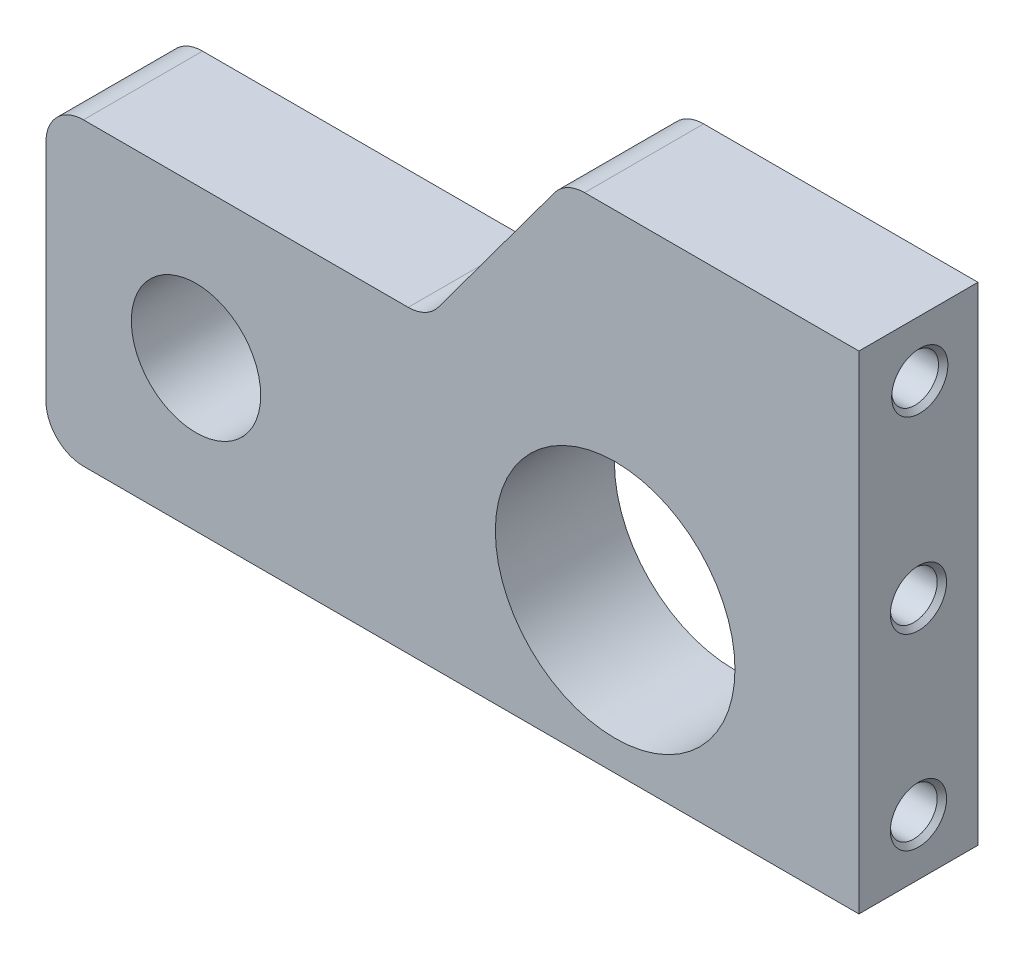
from build123d import *

# Parameters (mm, degrees)
SKETCH1_W           = 43.352
SKETCH1_H           = 16
BOSS_EXTRUDE1_DEPTH = 6.35
SKETCH1_6_R         = 6.39
SKETCH1_6_R_2       = 3.45
CUT_EXTRUDE1_DEPTH  = 6.35
FILLET1_R           = 2
SKETCH2_R           = 1.25
CUT_EXTRUDE2_DEPTH  = 5
BOSS_EXTRUDE2_DEPTH = 6.35
FILLET2_R           = 2
SKETCH4_R           = 1.25
CUT_EXTRUDE3_DEPTH  = 5
CHAMFER1_SIZE       = 0.25


with BuildPart() as part:
    # Sketch1 → Boss-Extrude1 (new body)
    with BuildSketch(Plane.XY):
        with Locations((21.676, 8)):
            Rectangle(SKETCH1_W, SKETCH1_H)
    extrude(amount=BOSS_EXTRUDE1_DEPTH)

    # Sketch1<6> → Cut-Extrude1 (cut)
    with BuildSketch(Plane.XY):
        with Locations((30.352, 8)):
            Circle(SKETCH1_6_R)
        with Locations((8, 8)):
            Circle(SKETCH1_6_R_2)
    extrude(amount=CUT_EXTRUDE1_DEPTH, mode=Mode.SUBTRACT)

    # Fillet1
    fillet1_edges = [part.edges().sort_by_distance(p)[0] for p in [
        (0, 16, 3.175),
        (0, 0, 3.175),
    ]]
    fillet(fillet1_edges, radius=FILLET1_R)

    # Sketch2 → Cut-Extrude2 (cut)
    with BuildSketch(Plane(origin=(43.352, 0, 0), x_dir=(0, 0, -1), z_dir=(1, 0, 0))):
        with Locations((-3.175, 13)):
            Circle(SKETCH2_R)
        with Locations((-3.175, 3)):
            Circle(SKETCH2_R)
    extrude(amount=-CUT_EXTRUDE2_DEPTH, mode=Mode.SUBTRACT)

    # Sketch3 → Boss-Extrude2 (add)
    with BuildSketch(Plane.XY.offset(6.35)):
        Polygon((20.326281713, 16), (43.352, 16), (43.352, 26), (27.712043107, 26), align=None)
    extrude(amount=-BOSS_EXTRUDE2_DEPTH)

    # Fillet2
    fillet2_edges = [part.edges().sort_by_distance(p)[0] for p in [
        (20.326281713, 16, 3.175),
        (27.712043107, 26, 3.175),
    ]]
    fillet(fillet2_edges, radius=FILLET2_R)

    # Sketch4 → Cut-Extrude3 (cut)
    with BuildSketch(Plane(origin=(43.352, 0, 0), x_dir=(0, 0, -1), z_dir=(1, 0, 0))):
        with Locations((-3.10572404, 23)):
            Circle(SKETCH4_R)
    extrude(amount=-CUT_EXTRUDE3_DEPTH, mode=Mode.SUBTRACT)

    # Chamfer1
    chamfer1_edges = [part.edges().sort_by_distance(p)[0] for p in [
        (43.352, 3, 4.425),
        (43.352, 13, 4.425),
        (43.352, 23, 4.35572404),
    ]]
    chamfer(chamfer1_edges, length=CHAMFER1_SIZE)


solid = part.part
